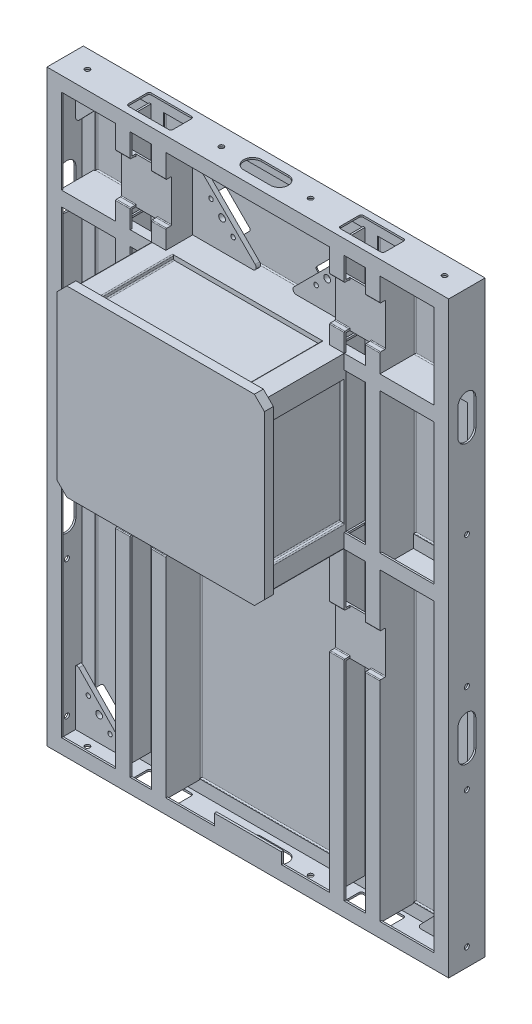
from build123d import *

# Parameters (mm, degrees)
CROQUIS1_W                  = 900
CROQUIS1_H                  = 2635
SALIENTE_EXTRUIR1_DEPTH     = 5
CROQUIS3_W                  = 243
CROQUIS3_H                  = 1365
CROQUIS3_H_2                = 380
CROQUIS3_W_2                = 95
CROQUIS3_H_3                = 630
SALIENTE_EXTRUIR2_DEPTH     = 8
CROQUIS4_W                  = 209
CROQUIS4_H                  = 437
CROQUIS4_H_2                = 1422
CROQUIS4_W_2                = 300
CROQUIS4_H_3                = 744
SALIENTE_EXTRUIR4_DEPTH     = 150
CROQUIS6_W                  = 243
CROQUIS6_H                  = 380
CROQUIS6_W_2                = 95
CROQUIS6_H_2                = 630
CROQUIS6_H_3                = 1365
SALIENTE_EXTRUIR5_DEPTH     = 8
CROQUIS7_R                  = 11
CORTAR_EXTRUIR1_DEPTH       = 50
CORTAR_EXTRUIR3_DEPTH       = 142
REDONDEO1_R                 = 5
CROQUIS13_W                 = 367
CROQUIS13_H                 = 57
CROQUIS13_H_2               = 630
SALIENTE_EXTRUIR10_DEPTH    = 158
CROQUIS14_W                 = 225
CROQUIS14_H                 = 206
SALIENTE_EXTRUIR11_DEPTH    = 33
CORTAR_EXTRUIR4_DEPTH       = 25
REDONDEO2_R                 = 3.5
CROQUIS16_R                 = 10
CROQUIS16_R_2               = 15
SALIENTE_EXTRUIR12_DEPTH    = 20
CROQUIS17_R                 = 15
CROQUIS17_R_2               = 10
SALIENTE_EXTRUIR13_DEPTH    = 20
CROQUIS18_R                 = 11
CORTAR_EXTRUIR5_DEPTH       = 30
CROQUIS19_W                 = 150
CROQUIS19_H                 = 50
SALIENTE_EXTRUIR14_DEPTH    = 10
CORTAR_EXTRUIR6_DEPTH       = 1450
CORTAR_EXTRUIR7_START       = -50
CROQUIS22_R                 = 11
CORTAR_EXTRUIR7_DEPTH       = 50
CORTAR_EXTRUIR10_DEPTH      = 2790.228208663
CORTAR_EXTRUIR10_DEPTH_BACK = 15
SALIENTE_EXTRUIR15_DEPTH    = 350
SALIENTE_EXTRUIR16_DEPTH    = 40


with BuildPart() as part:
    # Croquis1 → Saliente-Extruir1 (new body)
    with BuildSketch(Plane.XY):
        with Locations((450, 1317.5)):
            Rectangle(CROQUIS1_W, CROQUIS1_H)
    extrude(amount=SALIENTE_EXTRUIR1_DEPTH)

    # Croquis3 → Saliente-Extruir2 (add)
    with BuildSketch(Plane.XY.offset(5)):
        Polygon((0, 0), (0, 2125), (0, 2190), (0, 2635), (900, 2635), (900, 2570), (533, 2570), (533, 2190), (900, 2190), (900, 2125), (533, 2125), (533, 1495), (900, 1495), (900, 1430), (533, 1430), (533, 65), (900, 65), (900, 0), align=None)
        with Locations((186.5, 747.5)):
            Rectangle(CROQUIS3_W, CROQUIS3_H, mode=Mode.SUBTRACT)
        with Locations((186.5, 2380)):
            Rectangle(CROQUIS3_W, CROQUIS3_H_2, mode=Mode.SUBTRACT)
        with Locations((420.5, 2380)):
            Rectangle(CROQUIS3_W_2, CROQUIS3_H_2, mode=Mode.SUBTRACT)
        with Locations((420.5, 747.5)):
            Rectangle(CROQUIS3_W_2, CROQUIS3_H, mode=Mode.SUBTRACT)
        with Locations((186.5, 1810)):
            Rectangle(CROQUIS3_W, CROQUIS3_H_3, mode=Mode.SUBTRACT)
        with Locations((420.5, 1810)):
            Rectangle(CROQUIS3_W_2, CROQUIS3_H_3, mode=Mode.SUBTRACT)
    extrude(amount=SALIENTE_EXTRUIR2_DEPTH)

    # Redondeo1
    redondeo1_edges = [part.edges().sort_by_distance(p)[0] for p in [
        (65, 1810, 5),
        (186.5, 2125, 5),
        (65, 2380, 5),
        (186.5, 2570, 5),
        (373, 2380, 5),
        (420.5, 2570, 5),
        (65, 747.5, 5),
        (186.5, 1430, 5),
        (373, 1810, 5),
        (373, 747.5, 5),
        (420.5, 1430, 5),
        (533, 747.5, 5),
        (716.5, 1430, 5),
        (533, 2380, 5),
        (716.5, 2570, 5),
        (420.5, 2125, 5),
        (716.5, 65, 5),
        (716.5, 2190, 5),
        (420.5, 65, 5),
        (468, 747.5, 5),
        (468, 1810, 5),
        (420.5, 1495, 5),
        (186.5, 65, 5),
        (308, 747.5, 5),
        (420.5, 2190, 5),
        (468, 2380, 5),
        (186.5, 2190, 5),
        (308, 2380, 5),
        (186.5, 1495, 5),
        (308, 1810, 5),
    ]]
    fillet(redondeo1_edges, radius=REDONDEO1_R)



with BuildPart() as body_2:
    # Croquis4 → Saliente-Extruir4 (new body)
    with BuildSketch(Plane.XY.offset(13)):
        Polygon((533, 2190), (533, 2627), (900, 2627), (900, 2635), (0, 2635), (0, 0), (900, 0), (900, 8), (533, 8), (533, 1430), (900, 1430), (900, 1438), (533, 1438), (533, 2182), (900, 2182), (900, 2190), align=None)
        with Locations((420.5, 2408.5)):
            Rectangle(CROQUIS4_W, CROQUIS4_H, mode=Mode.SUBTRACT)
        with Locations((420.5, 719)):
            Rectangle(CROQUIS4_W, CROQUIS4_H_2, mode=Mode.SUBTRACT)
        Polygon((308, 1430), (308, 8), (8, 8), (8, 2182), (308, 2182), (308, 1438), (65, 1438), (65, 1430), align=None, mode=Mode.SUBTRACT)
        with Locations((158, 2408.5)):
            Rectangle(CROQUIS4_W_2, CROQUIS4_H, mode=Mode.SUBTRACT)
        with Locations((420.5, 1810)):
            Rectangle(CROQUIS4_W, CROQUIS4_H_3, mode=Mode.SUBTRACT)
    extrude(amount=SALIENTE_EXTRUIR4_DEPTH)

    # Croquis6 → Saliente-Extruir5 (add)
    with BuildSketch(Plane.XY.offset(163)):
        Polygon((900, 65), (533, 65), (533, 1430), (900, 1430), (900, 1495), (533, 1495), (533, 2125), (900, 2125), (900, 2190), (533, 2190), (533, 2570), (900, 2570), (900, 2635), (0, 2635), (0, 0), (900, 0), align=None)
        with Locations((186.5, 2380)):
            Rectangle(CROQUIS6_W, CROQUIS6_H, mode=Mode.SUBTRACT)
        with Locations((420.5, 2380)):
            Rectangle(CROQUIS6_W_2, CROQUIS6_H, mode=Mode.SUBTRACT)
        with Locations((186.5, 1810)):
            Rectangle(CROQUIS6_W, CROQUIS6_H_2, mode=Mode.SUBTRACT)
        with Locations((420.5, 1810)):
            Rectangle(CROQUIS6_W_2, CROQUIS6_H_2, mode=Mode.SUBTRACT)
        with Locations((186.5, 747.5)):
            Rectangle(CROQUIS6_W, CROQUIS6_H_3, mode=Mode.SUBTRACT)
        with Locations((420.5, 747.5)):
            Rectangle(CROQUIS6_W_2, CROQUIS6_H_3, mode=Mode.SUBTRACT)
    extrude(amount=-SALIENTE_EXTRUIR5_DEPTH)

    # Croquis7 → Cortar-Extruir1 (cut)
    with BuildSketch(Plane.ZY):
        with Locations((81.5, 1680)):
            Circle(CROQUIS7_R)
        with Locations((81.5, 1090)):
            Circle(CROQUIS7_R)
        with Locations((81.5, 80)):
            Circle(CROQUIS7_R)
        with Locations((81.5, 690)):
            Circle(CROQUIS7_R)
        with BuildLine():
            Line((121.5, 2195), (121.5, 2075))
            ThreePointArc((121.5, 2075), (81.5, 2035), (41.5, 2075))
            Line((41.5, 2075), (41.5, 2195))
            ThreePointArc((41.5, 2195), (81.5, 2235), (121.5, 2195))
        make_face()
        with BuildLine():
            Line((121.5, 950), (121.5, 830))
            ThreePointArc((121.5, 830), (81.5, 790), (41.5, 830))
            Line((41.5, 830), (41.5, 950))
            ThreePointArc((41.5, 950), (81.5, 990), (121.5, 950))
        make_face()
    extrude(amount=-CORTAR_EXTRUIR1_DEPTH, mode=Mode.SUBTRACT)

    # Croquis9 → Cortar-Extruir3 (cut)
    with BuildSketch(Plane.XY.offset(13)):
        Polygon((60, 2575), (900, 2575), (900, 2627), (533, 2627), (525, 2627), (316, 2627), (308, 2627), (65, 2627), (8, 2627), (8, 2570), (8, 2190), (8, 2182), (8, 1438), (8, 1430), (8, 65), (8, 8), (65, 8), (308, 8), (316, 8), (525, 8), (533, 8), (900, 8), (900, 60), (60, 60), align=None)
    extrude(amount=CORTAR_EXTRUIR3_DEPTH, mode=Mode.SUBTRACT)


with BuildPart() as part_1:
    add(part.part)

    add(body_2.part)  # Saliente-Extruir10 merges body 2
    # Croquis13 → Saliente-Extruir10 (add)
    with BuildSketch(Plane.XY.offset(5)):
        with Locations((716.5, 2153.5)):
            Rectangle(CROQUIS13_W, CROQUIS13_H)
        with Locations((716.5, 1810)):
            Rectangle(CROQUIS13_W, CROQUIS13_H_2)
        with Locations((716.5, 1466.5)):
            Rectangle(CROQUIS13_W, CROQUIS13_H)
    extrude(amount=SALIENTE_EXTRUIR10_DEPTH)

    # Croquis14 → Saliente-Extruir11 (add)
    with BuildSketch(Plane.XY.offset(163)):
        with Locations((420.5, 1097)):
            Rectangle(CROQUIS14_W, CROQUIS14_H)
        with Locations((420.5, 2369)):
            Rectangle(CROQUIS14_W, CROQUIS14_H)
    extrude(amount=-SALIENTE_EXTRUIR11_DEPTH)

    # Croquis15 → Cortar-Extruir4 (cut)
    with BuildSketch(Plane.XY.offset(163)):
        Polygon((533, 2274), (533, 2464), (468, 2464), (468, 2472), (373, 2472), (373, 2464), (308, 2464), (308, 2274), (373, 2274), (373, 2266), (468, 2266), (468, 2274), align=None)
        Polygon((533, 1002), (533, 1192), (468, 1192), (468, 1200), (373, 1200), (373, 1192), (308, 1192), (308, 1002), (373, 1002), (373, 994), (468, 994), (468, 1002), align=None)
    extrude(amount=-CORTAR_EXTRUIR4_DEPTH, mode=Mode.SUBTRACT)

    # Redondeo2
    redondeo2_edges = [part_1.edges().sort_by_distance(p)[0] for p in [
        (340.5, 1002, 138),
        (340.5, 1192, 138),
        (500.5, 1192, 138),
        (500.5, 1002, 138),
        (500.5, 1002, 163),
        (500.5, 1192, 163),
        (340.5, 1192, 163),
        (340.5, 1002, 163),
        (500.5, 2464, 138),
        (500.5, 2274, 138),
        (340.5, 2274, 138),
        (340.5, 2464, 138),
        (340.5, 2464, 163),
        (340.5, 2274, 163),
        (500.5, 2274, 163),
        (500.5, 2464, 163),
    ]]
    fillet(redondeo2_edges, radius=REDONDEO2_R)

    # Croquis16 → Saliente-Extruir12 (add)
    # profile 1 of 2: a face of its own
    with BuildSketch(Plane(origin=(0, 0, 43), x_dir=(-1, 0, 0), z_dir=(0, 0, -1))):
        with BuildLine():
            ThreePointArc((-8, 255.26539567), (-15.5, 258.442029221), (-23, 255.26539567))
            Line((-23, 255.26539567), (-135.5, 139.132697835))
            Line((-135.5, 139.132697835), (-248, 23))
            ThreePointArc((-248, 23), (-251.037029249, 15.5), (-248, 8))
            Line((-248, 8), (-8, 8))
            Line((-8, 8), (-8, 255.26539567))
        make_face()
        with Locations(Location((-162.65733608, 67.981597373, 0), (0, 0, 180))):
            Circle(CROQUIS16_R, mode=Mode.SUBTRACT)
        with Locations(Location((-113.952464052, 118.259181251, 0), (0, 0, 180))):
            Circle(CROQUIS16_R_2, mode=Mode.SUBTRACT)
        with Locations(Location((-65.247592023, 168.53676513, 0), (0, 0, 180))):
            Circle(CROQUIS16_R, mode=Mode.SUBTRACT)
    # profile 2 of 2: a face of its own
    with BuildSketch(Plane(origin=(0, 0, 43), x_dir=(-1, 0, 0), z_dir=(0, 0, -1))):
        with BuildLine():
            Line((-8, 2627), (-248, 2627))
            ThreePointArc((-248, 2627), (-251.037029249, 2619.5), (-248, 2612))
            Line((-248, 2612), (-23, 2379.73460433))
            ThreePointArc((-23, 2379.73460433), (-15.5, 2376.557970779), (-8, 2379.73460433))
            Line((-8, 2379.73460433), (-8, 2627))
        make_face()
        with Locations(Location((-113.952464052, 2516.740818749, 0), (0, 0, 180))):
            Circle(CROQUIS16_R_2, mode=Mode.SUBTRACT)
        with Locations(Location((-162.65733608, 2567.018402627, 0), (0, 0, 180))):
            Circle(CROQUIS16_R, mode=Mode.SUBTRACT)
        with Locations(Location((-65.247592024, 2466.46323487, 0), (0, 0, 180))):
            Circle(CROQUIS16_R, mode=Mode.SUBTRACT)
    extrude(amount=SALIENTE_EXTRUIR12_DEPTH)

    # Croquis17 → Saliente-Extruir13 (add)
    # profile 1 of 2: a face of its own
    with BuildSketch(Plane.XY.offset(43)):
        with BuildLine():
            Line((558.606601718, 1150), (813, 1404.393398282))
            ThreePointArc((813, 1404.393398282), (816.25159127, 1420.740251485), (802.393398282, 1430))
            Line((802.393398282, 1430), (533, 1430))
            Line((533, 1430), (533, 1160.606601718))
            ThreePointArc((533, 1160.606601718), (542.259748515, 1146.74840873), (558.606601718, 1150))
        make_face()
        with Locations((664.590097423, 1298.409902577)):
            Circle(CROQUIS17_R, mode=Mode.SUBTRACT)
        with Locations((714.087572106, 1347.90737726)):
            Circle(CROQUIS17_R_2, mode=Mode.SUBTRACT)
        with Locations((615.09262274, 1248.912427894)):
            Circle(CROQUIS17_R_2, mode=Mode.SUBTRACT)
    # profile 2 of 2: a face of its own
    with BuildSketch(Plane.XY.offset(43)):
        with BuildLine():
            Line((802.393398282, 2190), (533, 2190))
            Line((533, 2190), (533, 2459.393398282))
            ThreePointArc((533, 2459.393398282), (542.259748515, 2473.25159127), (558.606601718, 2470))
            Line((558.606601718, 2470), (813, 2215.606601718))
            ThreePointArc((813, 2215.606601718), (816.25159127, 2199.259748515), (802.393398282, 2190))
        make_face()
        with Locations((615.09262274, 2371.087572106)):
            Circle(CROQUIS17_R_2, mode=Mode.SUBTRACT)
        with Locations((714.087572106, 2272.09262274)):
            Circle(CROQUIS17_R_2, mode=Mode.SUBTRACT)
        with Locations((664.590097423, 2321.590097423)):
            Circle(CROQUIS17_R, mode=Mode.SUBTRACT)
    extrude(amount=-SALIENTE_EXTRUIR13_DEPTH)

    # Croquis18 → Cortar-Extruir5 (cut)
    with BuildSketch(Plane.XZ):
        with Locations(Location((100, 81.5, 0), (0, 0, 270))):
            Circle(CROQUIS18_R)
        with BuildLine():
            Line((335, 133), (515, 133))
            ThreePointArc((515, 133), (522.071067812, 130.071067812), (525, 123))
            Line((525, 123), (525, 40))
            ThreePointArc((525, 40), (522.071067812, 32.928932188), (515, 30))
            Line((515, 30), (335, 30))
            ThreePointArc((335, 30), (327.928932188, 32.928932188), (325, 40))
            Line((325, 40), (325, 123))
            ThreePointArc((325, 123), (327.928932188, 130.071067812), (335, 133))
        make_face()
        with BuildLine():
            Line((840, 41.5), (900, 41.5))
            Line((900, 41.5), (900, 121.5))
            Line((900, 121.5), (840, 121.5))
            ThreePointArc((840, 121.5), (800, 81.5), (840, 41.5))
        make_face()
        with Locations(Location((700, 81.5, 0), (0, 0, 270))):
            Circle(CROQUIS18_R)
    extrude(amount=-CORTAR_EXTRUIR5_DEPTH, mode=Mode.SUBTRACT)

    # Croquis19 → Saliente-Extruir14 (add)
    with BuildSketch(Plane.XY.offset(163)):
        with Locations((825, 90)):
            Rectangle(CROQUIS19_W, CROQUIS19_H)
    extrude(amount=-SALIENTE_EXTRUIR14_DEPTH)

    # Croquis21 → Cortar-Extruir6 (cut)
    with BuildSketch(Plane(origin=(0, 1080, 0), x_dir=(1, 0, 0), z_dir=(0, 1, 0))):
        with BuildLine():
            Line((323.5, -23), (323.5, -120))
            ThreePointArc((323.5, -120), (324.232233047, -121.767766953), (326, -122.5))
            Line((326, -122.5), (515, -122.5))
            ThreePointArc((515, -122.5), (516.767766953, -121.767766953), (517.5, -120))
            Line((517.5, -120), (517.5, -23))
            ThreePointArc((517.5, -23), (516.767766953, -21.232233047), (515, -20.5))
            Line((515, -20.5), (326, -20.5))
            ThreePointArc((326, -20.5), (324.232233047, -21.232233047), (323.5, -23))
        make_face()
    extrude(amount=CORTAR_EXTRUIR6_DEPTH, mode=Mode.SUBTRACT)

    # Croquis22 → Cortar-Extruir7 (cut)
    with BuildSketch(Plane(origin=(0, 2635, 0), x_dir=(1, 0, 0), z_dir=(0, 1, 0)).offset(CORTAR_EXTRUIR7_START)):
        with Locations(Location((100, -81.5, 0), (0, 0, 90))):
            Circle(CROQUIS22_R)
        with BuildLine():
            Line((325, -40), (325, -123))
            ThreePointArc((325, -123), (327.928932188, -130.071067812), (335, -133))
            Line((335, -133), (515, -133))
            ThreePointArc((515, -133), (522.071067812, -130.071067812), (525, -123))
            Line((525, -123), (525, -40))
            ThreePointArc((525, -40), (522.071067812, -32.928932188), (515, -30))
            Line((515, -30), (335, -30))
            ThreePointArc((335, -30), (327.928932188, -32.928932188), (325, -40))
        make_face()
        with BuildLine():
            Line((900, -121.5), (900, -41.5))
            Line((900, -41.5), (840, -41.5))
            ThreePointArc((840, -41.5), (800, -81.5), (840, -121.5))
            Line((840, -121.5), (900, -121.5))
        make_face()
        with Locations(Location((700, -81.5, 0), (0, 0, 90))):
            Circle(CROQUIS22_R)
    extrude(amount=CORTAR_EXTRUIR7_DEPTH, mode=Mode.SUBTRACT)

    # Croquis23 → Cortar-Extruir10 (cut, two sides: drawn at the far end of the back side and taken through both)
    with BuildSketch(Plane(origin=(0, 0, 0), x_dir=(-1, 0, 0), z_dir=(0, 0, -1)).offset(-CORTAR_EXTRUIR10_DEPTH_BACK)):
        with BuildLine():
            Line((-749.442911166, 2307.4479618), (-650.4479618, 2406.442911166))
            ThreePointArc((-650.4479618, 2406.442911166), (-643.376893988, 2409.371843354), (-636.305826176, 2406.442911166))
            Line((-636.305826176, 2406.442911166), (-579.737283681, 2349.874368671))
            ThreePointArc((-579.737283681, 2349.874368671), (-576.808351493, 2342.803300859), (-579.737283681, 2335.732233047))
            Line((-579.737283681, 2335.732233047), (-678.732233047, 2236.737283681))
            ThreePointArc((-678.732233047, 2236.737283681), (-685.803300859, 2233.808351493), (-692.874368671, 2236.737283681))
            Line((-692.874368671, 2236.737283681), (-749.442911166, 2293.305826176))
            ThreePointArc((-749.442911166, 2293.305826176), (-752.371843354, 2300.376893988), (-749.442911166, 2307.4479618))
        make_face()
        with BuildLine():
            Line((-101.160151937, 2431.674040564), (-198.569895994, 2532.229208321))
            ThreePointArc((-198.569895994, 2532.229208321), (-201.386121981, 2539.34591507), (-198.345222872, 2546.369559165))
            Line((-198.345222872, 2546.369559165), (-140.885127011, 2602.032270055))
            ThreePointArc((-140.885127011, 2602.032270055), (-133.768420262, 2604.848496042), (-126.744776167, 2601.807596933))
            Line((-126.744776167, 2601.807596933), (-29.33503211, 2501.252429176))
            ThreePointArc((-29.33503211, 2501.252429176), (-26.518806123, 2494.135722427), (-29.559705232, 2487.112078332))
            Line((-29.559705232, 2487.112078332), (-87.019801093, 2431.449367442))
            ThreePointArc((-87.019801093, 2431.449367442), (-94.136507842, 2428.633141455), (-101.160151937, 2431.674040564))
        make_face()
        with BuildLine():
            Line((-692.874368671, 1383.262716319), (-749.442911166, 1326.694173824))
            ThreePointArc((-749.442911166, 1326.694173824), (-752.371843354, 1319.623106012), (-749.442911166, 1312.5520382))
            Line((-749.442911166, 1312.5520382), (-650.4479618, 1213.557088834))
            ThreePointArc((-650.4479618, 1213.557088834), (-643.376893988, 1210.628156646), (-636.305826176, 1213.557088834))
            Line((-636.305826176, 1213.557088834), (-579.737283681, 1270.125631329))
            ThreePointArc((-579.737283681, 1270.125631329), (-576.808351493, 1277.196699141), (-579.737283681, 1284.267766953))
            Line((-579.737283681, 1284.267766953), (-678.732233047, 1383.262716319))
            ThreePointArc((-678.732233047, 1383.262716319), (-685.803300859, 1386.191648507), (-692.874368671, 1383.262716319))
        make_face()
        with BuildLine():
            Line((-29.09965031, 146.543452499), (-85.668192804, 203.111994994))
            ThreePointArc((-85.668192804, 203.111994994), (-92.739260616, 206.040927182), (-99.810328428, 203.111994994))
            Line((-99.810328428, 203.111994994), (-198.805277794, 104.117045628))
            ThreePointArc((-198.805277794, 104.117045628), (-201.734209982, 97.045977816), (-198.805277794, 89.974910004))
            Line((-198.805277794, 89.974910004), (-142.236735299, 33.406367509))
            ThreePointArc((-142.236735299, 33.406367509), (-135.165667488, 30.477435321), (-128.094599676, 33.406367509))
            Line((-128.094599676, 33.406367509), (-29.09965031, 132.401316875))
            ThreePointArc((-29.09965031, 132.401316875), (-26.170718121, 139.472384687), (-29.09965031, 146.543452499))
        make_face()
    extrude(amount=CORTAR_EXTRUIR10_DEPTH + CORTAR_EXTRUIR10_DEPTH_BACK, mode=Mode.SUBTRACT)

    # Simetría4: part across plane


with BuildPart() as part_2:
    add(part_1.part)
    add(part_1.part.mirror(Plane(origin=(900, 0, 5), x_dir=(0, 0, 1), z_dir=(-1, 0, 0))))

    # Croquis24 → Saliente-Extruir15 (add)
    with BuildSketch(Plane.XY.offset(163)):
        with BuildLine():
            Line((472, 1430), (562, 1430))
            ThreePointArc((562, 1430), (565.535533906, 1431.464466094), (567, 1435))
            Line((567, 1435), (567, 1445))
            ThreePointArc((567, 1445), (568.464466094, 1448.535533906), (572, 1450))
            Line((572, 1450), (1227, 1450))
            ThreePointArc((1227, 1450), (1230.535533906, 1448.535533906), (1232, 1445))
            Line((1232, 1445), (1232, 1435))
            ThreePointArc((1232, 1435), (1233.464466094, 1431.464466094), (1237, 1430))
            Line((1237, 1430), (1327, 1430))
            ThreePointArc((1327, 1430), (1330.535533906, 1431.464466094), (1332, 1435))
            Line((1332, 1435), (1332, 1525))
            ThreePointArc((1332, 1525), (1330.535533906, 1528.535533906), (1327, 1530))
            Line((1327, 1530), (1317, 1530))
            ThreePointArc((1317, 1530), (1313.464466094, 1531.464466094), (1312, 1535))
            Line((1312, 1535), (1312, 2085))
            ThreePointArc((1312, 2085), (1313.464466094, 2088.535533906), (1317, 2090))
            Line((1317, 2090), (1332, 2090))
            Line((1332, 2090), (1332, 2190))
            Line((1332, 2190), (1237, 2190))
            ThreePointArc((1237, 2190), (1233.464466094, 2188.535533906), (1232, 2185))
            Line((1232, 2185), (1232, 2175))
            ThreePointArc((1232, 2175), (1230.535533906, 2171.464466094), (1227, 2170))
            Line((1227, 2170), (572, 2170))
            ThreePointArc((572, 2170), (568.464466094, 2171.464466094), (567, 2175))
            Line((567, 2175), (567, 2185))
            ThreePointArc((567, 2185), (565.535533906, 2188.535533906), (562, 2190))
            Line((562, 2190), (472, 2190))
            ThreePointArc((472, 2190), (468.464466094, 2188.535533906), (467, 2185))
            Line((467, 2185), (467, 2095))
            ThreePointArc((467, 2095), (468.464466094, 2091.464466094), (472, 2090))
            Line((472, 2090), (482, 2090))
            ThreePointArc((482, 2090), (485.535533906, 2088.535533906), (487, 2085))
            Line((487, 2085), (487, 1535))
            ThreePointArc((487, 1535), (485.535533906, 1531.464466094), (482, 1530))
            Line((482, 1530), (472, 1530))
            ThreePointArc((472, 1530), (468.464466094, 1528.535533906), (467, 1525))
            Line((467, 1525), (467, 1435))
            ThreePointArc((467, 1435), (468.464466094, 1431.464466094), (472, 1430))
        make_face()
    extrude(amount=SALIENTE_EXTRUIR15_DEPTH)

    # Croquis25 → Saliente-Extruir16 (add)
    # profile 1 of 2: a face of its own
    with BuildSketch(Plane.XY.offset(513)):
        Polygon((434.5, 2175), (479.5, 2220), (1319.5, 2220), (1364.5, 2175), (1364.5, 1445), (1319.5, 1400), (479.5, 1400), (434.5, 1445), align=None)
        with BuildLine():
            Line((1332, 2090), (1332, 2190))
            Line((1332, 2190), (1237, 2190))
            ThreePointArc((1237, 2190), (1233.464466094, 2188.535533906), (1232, 2185))
            Line((1232, 2185), (1232, 2175))
            ThreePointArc((1232, 2175), (1230.535533906, 2171.464466094), (1227, 2170))
            Line((1227, 2170), (572, 2170))
            ThreePointArc((572, 2170), (568.464466094, 2171.464466094), (567, 2175))
            Line((567, 2175), (567, 2185))
            ThreePointArc((567, 2185), (565.535533906, 2188.535533906), (562, 2190))
            Line((562, 2190), (472, 2190))
            ThreePointArc((472, 2190), (468.464466094, 2188.535533906), (467, 2185))
            Line((467, 2185), (467, 2095))
            ThreePointArc((467, 2095), (468.464466094, 2091.464466094), (472, 2090))
            Line((472, 2090), (482, 2090))
            ThreePointArc((482, 2090), (485.535533906, 2088.535533906), (487, 2085))
            Line((487, 2085), (487, 1535))
            ThreePointArc((487, 1535), (485.535533906, 1531.464466094), (482, 1530))
            Line((482, 1530), (472, 1530))
            ThreePointArc((472, 1530), (468.464466094, 1528.535533906), (467, 1525))
            Line((467, 1525), (467, 1435))
            ThreePointArc((467, 1435), (468.464466094, 1431.464466094), (472, 1430))
            Line((472, 1430), (562, 1430))
            ThreePointArc((562, 1430), (565.535533906, 1431.464466094), (567, 1435))
            Line((567, 1435), (567, 1445))
            ThreePointArc((567, 1445), (568.464466094, 1448.535533906), (572, 1450))
            Line((572, 1450), (1227, 1450))
            ThreePointArc((1227, 1450), (1230.535533906, 1448.535533906), (1232, 1445))
            Line((1232, 1445), (1232, 1435))
            ThreePointArc((1232, 1435), (1233.464466094, 1431.464466094), (1237, 1430))
            Line((1237, 1430), (1327, 1430))
            ThreePointArc((1327, 1430), (1330.535533906, 1431.464466094), (1332, 1435))
            Line((1332, 1435), (1332, 1525))
            ThreePointArc((1332, 1525), (1330.535533906, 1528.535533906), (1327, 1530))
            Line((1327, 1530), (1317, 1530))
            ThreePointArc((1317, 1530), (1313.464466094, 1531.464466094), (1312, 1535))
            Line((1312, 1535), (1312, 2085))
            ThreePointArc((1312, 2085), (1313.464466094, 2088.535533906), (1317, 2090))
            Line((1317, 2090), (1332, 2090))
        make_face(mode=Mode.SUBTRACT)
    # profile 2 of 2: a face of its own
    with BuildSketch(Plane.XY.offset(513)):
        with BuildLine():
            Line((1317, 2090), (1332, 2090))
            Line((1332, 2090), (1332, 2190))
            Line((1332, 2190), (1237, 2190))
            ThreePointArc((1237, 2190), (1233.464466094, 2188.535533906), (1232, 2185))
            Line((1232, 2185), (1232, 2175))
            ThreePointArc((1232, 2175), (1230.535533906, 2171.464466094), (1227, 2170))
            Line((1227, 2170), (572, 2170))
            ThreePointArc((572, 2170), (568.464466094, 2171.464466094), (567, 2175))
            Line((567, 2175), (567, 2185))
            ThreePointArc((567, 2185), (565.535533906, 2188.535533906), (562, 2190))
            Line((562, 2190), (472, 2190))
            ThreePointArc((472, 2190), (468.464466094, 2188.535533906), (467, 2185))
            Line((467, 2185), (467, 2095))
            ThreePointArc((467, 2095), (468.464466094, 2091.464466094), (472, 2090))
            Line((472, 2090), (482, 2090))
            ThreePointArc((482, 2090), (485.535533906, 2088.535533906), (487, 2085))
            Line((487, 2085), (487, 1535))
            ThreePointArc((487, 1535), (485.535533906, 1531.464466094), (482, 1530))
            Line((482, 1530), (472, 1530))
            ThreePointArc((472, 1530), (468.464466094, 1528.535533906), (467, 1525))
            Line((467, 1525), (467, 1435))
            ThreePointArc((467, 1435), (468.464466094, 1431.464466094), (472, 1430))
            Line((472, 1430), (562, 1430))
            ThreePointArc((562, 1430), (565.535533906, 1431.464466094), (567, 1435))
            Line((567, 1435), (567, 1445))
            ThreePointArc((567, 1445), (568.464466094, 1448.535533906), (572, 1450))
            Line((572, 1450), (1227, 1450))
            ThreePointArc((1227, 1450), (1230.535533906, 1448.535533906), (1232, 1445))
            Line((1232, 1445), (1232, 1435))
            ThreePointArc((1232, 1435), (1233.464466094, 1431.464466094), (1237, 1430))
            Line((1237, 1430), (1327, 1430))
            ThreePointArc((1327, 1430), (1330.535533906, 1431.464466094), (1332, 1435))
            Line((1332, 1435), (1332, 1525))
            ThreePointArc((1332, 1525), (1330.535533906, 1528.535533906), (1327, 1530))
            Line((1327, 1530), (1317, 1530))
            ThreePointArc((1317, 1530), (1313.464466094, 1531.464466094), (1312, 1535))
            Line((1312, 1535), (1312, 2085))
            ThreePointArc((1312, 2085), (1313.464466094, 2088.535533906), (1317, 2090))
        make_face()
    extrude(amount=SALIENTE_EXTRUIR16_DEPTH)


solid = part_2.part
